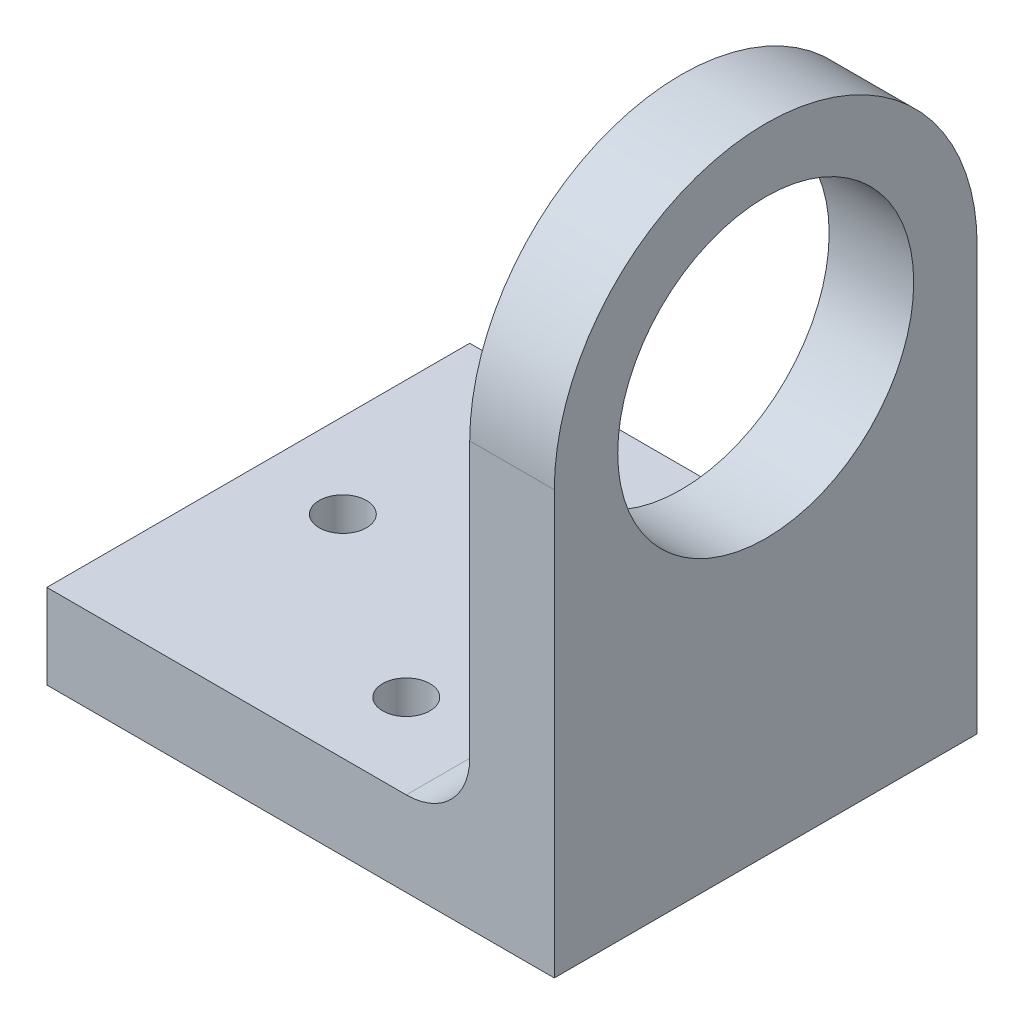
from build123d import *

# Parameters (mm, degrees)
SKETCH3_R           = 11.1125
BOSS_EXTRUDE1_DEPTH = 6.35
SKETCH5_W           = 31.75
SKETCH5_H           = 6.35
BOSS_EXTRUDE2_DEPTH = 38.1
FILLET1_R           = 4.7625
SKETCH6_R           = 1.777000002
CUT_EXTRUDE1_DEPTH  = 61.989758362


with BuildPart() as part:
    # Sketch3 → Boss-Extrude1 (new body)
    with BuildSketch(Plane(origin=(0, 0, 0), x_dir=(0, 0, -1), z_dir=(1, 0, 0))):
        with BuildLine():
            Line((0, 0), (31.75, 0))
            Line((31.75, 0), (31.75, 25.4))
            ThreePointArc((31.75, 25.4), (15.875, 41.275), (0, 25.4))
            Line((0, 25.4), (0, 0))
        make_face()
        with Locations((15.875, 25.4)):
            Circle(SKETCH3_R, mode=Mode.SUBTRACT)
    extrude(amount=BOSS_EXTRUDE1_DEPTH)

    # Sketch5 → Boss-Extrude2 (add)
    with BuildSketch(Plane(origin=(6.35, 0, 0), x_dir=(0, 0, -1), z_dir=(1, 0, 0))):
        with Locations((15.875, -3.175)):
            Rectangle(SKETCH5_W, SKETCH5_H)
    extrude(amount=-BOSS_EXTRUDE2_DEPTH)

    # Fillet1
    fillet1_edges = [part.edges().sort_by_distance(p)[0] for p in [
        (0, 0, -15.875),
    ]]
    fillet(fillet1_edges, radius=FILLET1_R)

    # Sketch6 → Cut-Extrude1 (cut, through all)
    with BuildSketch(Plane(origin=(0, 0, 0), x_dir=(1, 0, 0), z_dir=(0, 1, 0))):
        with Locations((-11.1125, 6.35)):
            Circle(SKETCH6_R)
        with Locations((-25.4, 15.875)):
            Circle(SKETCH6_R)
        with Locations((-11.1125, 25.4)):
            Circle(SKETCH6_R)
    extrude(amount=-CUT_EXTRUDE1_DEPTH, mode=Mode.SUBTRACT)


solid = part.part
